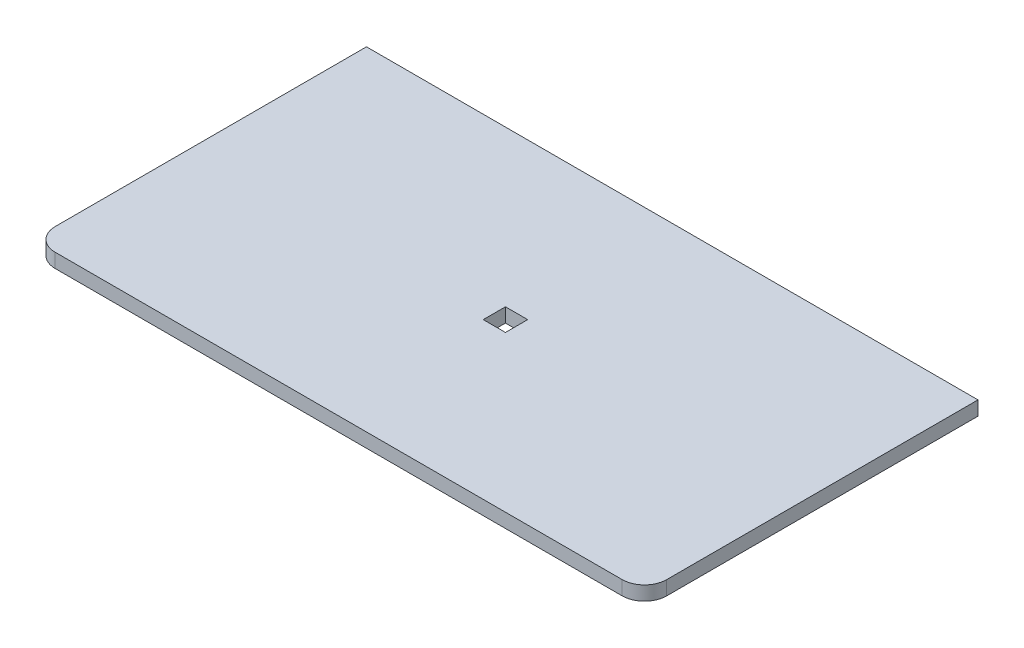
from build123d import *

# Parameters (mm, degrees)
SKETCH2_W           = 275
SKETCH2_H           = 150
BOSS_EXTRUDE1_DEPTH = 6.35
FILLET1_R           = 10
SKETCH3_W           = 10
SKETCH3_H           = 10
CUT_EXTRUDE1_DEPTH  = 157.753221657


with BuildPart() as part:
    # Sketch2 → Boss-Extrude1 (new body)
    with BuildSketch(Plane(origin=(0, 0, 0), x_dir=(1, 0, 0), z_dir=(0, 1, 0))):
        Rectangle(SKETCH2_W, SKETCH2_H)
    extrude(amount=BOSS_EXTRUDE1_DEPTH)

    # Fillet1
    fillet1_edges = [part.edges().sort_by_distance(p)[0] for p in [
        (137.5, 3.175, 75),
        (-137.5, 3.175, 75),
    ]]
    fillet(fillet1_edges, radius=FILLET1_R)

    # Sketch3 → Cut-Extrude1 (cut, through all)
    with BuildSketch(Plane(origin=(0, 6.35, 0), x_dir=(1, 0, 0), z_dir=(0, 1, 0))):
        Rectangle(SKETCH3_W, SKETCH3_H)
    extrude(amount=-CUT_EXTRUDE1_DEPTH, mode=Mode.SUBTRACT)


solid = part.part
